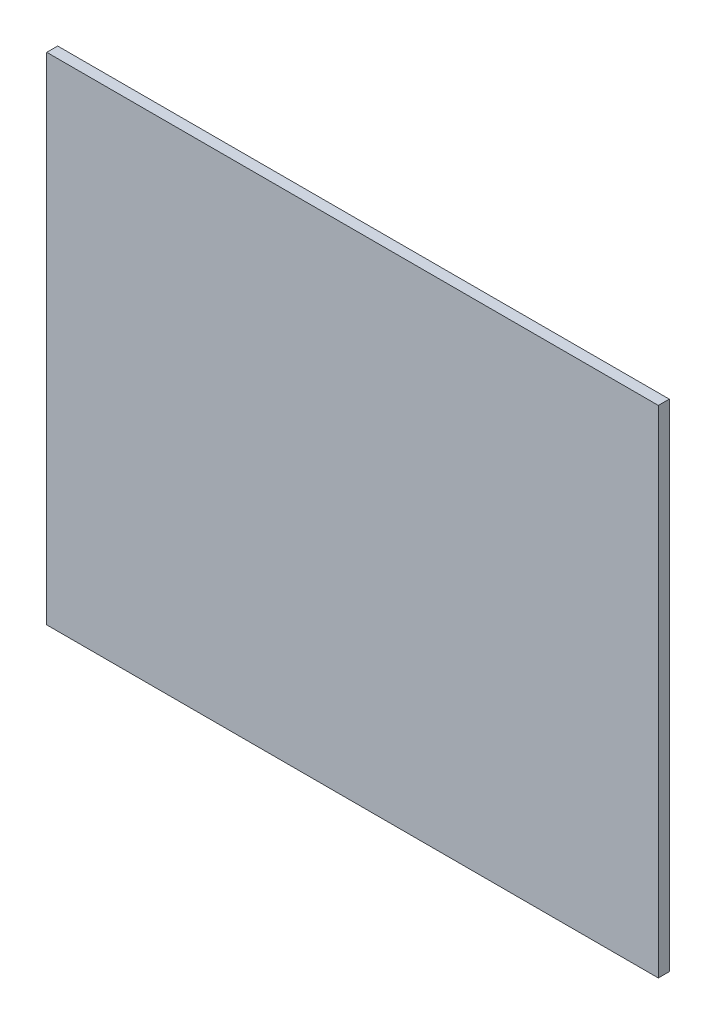
from build123d import *

# Parameters (mm, degrees)
SKETCH1_W           = 185
SKETCH1_H           = 150
BOSS_EXTRUDE1_DEPTH = 3.302


with BuildPart() as part:
    # Sketch1 → Boss-Extrude1 (new body)
    with BuildSketch(Plane.XY):
        with Locations((19.346681922, -34.71624714)):
            Rectangle(SKETCH1_W, SKETCH1_H)
    extrude(amount=BOSS_EXTRUDE1_DEPTH)


solid = part.part
